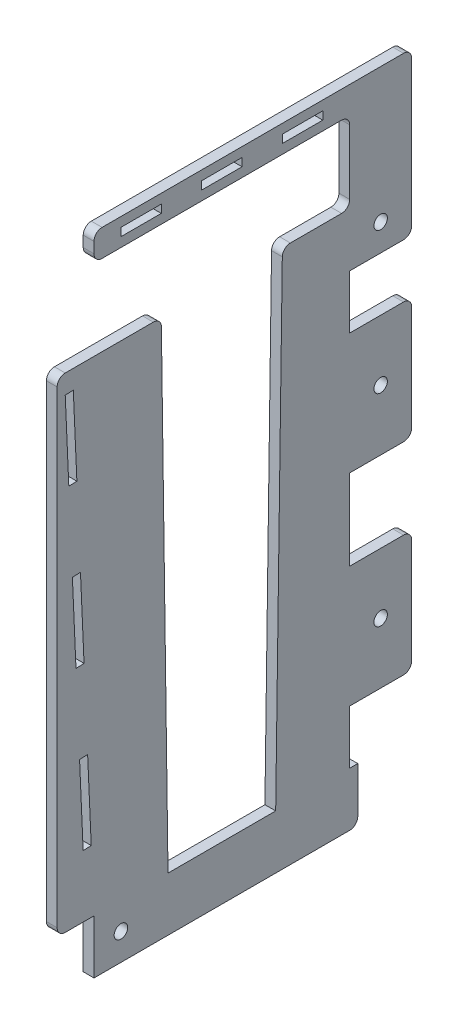
from build123d import *

# Parameters (mm, degrees)
SKETCH1_R           = 2.5
BOSS_EXTRUDE1_DEPTH = 4
SKETCH4_W           = 15
SKETCH4_H           = 3
BOSS_EXTRUDE2_DEPTH = 4
SKETCH5_W           = 13.685275767
SKETCH5_H           = 180
BOSS_EXTRUDE3_DEPTH = 4
CUT_EXTRUDE3_DEPTH  = 4
SKETCH11_W          = 3
SKETCH11_H          = 20
BOSS_EXTRUDE5_DEPTH = 4
FILLET1_R           = 3
SKETCH12_R          = 2.5
CUT_EXTRUDE7_DEPTH  = 4


with BuildPart() as part:
    # Sketch1 → Boss-Extrude1 (new body)
    with BuildSketch(Plane(origin=(0, 0, 0), x_dir=(0, 0, -1), z_dir=(1, 0, 0))):
        Polygon((0, 0), (-95, 0), (-95, 200), (23, 200), (23, 180), (0, 180), (0, 160), (23, 160), (23, 115), (0, 115), (0, 85), (23, 85), (23, 40), (0, 40), align=None)
        with Locations((11.5, 190)):
            Circle(SKETCH1_R, mode=Mode.SUBTRACT)
        with Locations((11.5, 137.5)):
            Circle(SKETCH1_R, mode=Mode.SUBTRACT)
        with Locations((11.5, 62.5)):
            Circle(SKETCH1_R, mode=Mode.SUBTRACT)
    extrude(amount=BOSS_EXTRUDE1_DEPTH)

    # Sketch4 → Boss-Extrude2 (add)
    with BuildSketch(Plane(origin=(4, 0, 0), x_dir=(0, 0, -1), z_dir=(1, 0, 0))):
        Polygon((-95, 230), (0, 230), (0, 200), (23, 200), (23, 240), (0, 240), (-95, 240), align=None)
        with Locations((-77.5, 235)):
            Rectangle(SKETCH4_W, SKETCH4_H, mode=Mode.SUBTRACT)
        with Locations((-47.5, 235)):
            Rectangle(SKETCH4_W, SKETCH4_H, mode=Mode.SUBTRACT)
        with Locations((-17.5, 235)):
            Rectangle(SKETCH4_W, SKETCH4_H, mode=Mode.SUBTRACT)
    extrude(amount=-BOSS_EXTRUDE2_DEPTH)

    # Sketch5 → Boss-Extrude3 (add)
    with BuildSketch(Plane(origin=(4, 0, 0), x_dir=(0, 0, -1), z_dir=(1, 0, 0))):
        with Locations((-101.842637884, 110)):
            Rectangle(SKETCH5_W, SKETCH5_H)
        Polygon((-97.360160713, 73.103616035), (-96.028142304, 43.133201841), (-99.025183723, 43), (-100.357202132, 72.970414194), align=None, mode=Mode.SUBTRACT)
        Polygon((-100.02419753, 133.044444423), (-98.692179121, 103.074030229), (-101.689220541, 102.940828388), (-103.021238949, 132.911242582), align=None, mode=Mode.SUBTRACT)
        Polygon((-102.688234347, 192.985272811), (-101.356215939, 163.014858617), (-104.353257358, 162.881656776), (-105.685275767, 192.85207097), align=None, mode=Mode.SUBTRACT)
    extrude(amount=-BOSS_EXTRUDE3_DEPTH)

    # Sketch6 → Cut-Extrude3 (cut)
    with BuildSketch(Plane(origin=(4, 0, 0), x_dir=(0, 0, -1), z_dir=(1, 0, 0))):
        Polygon((-25, 200), (-70, 200), (-67.5, 20), (-27.5, 20), align=None)
    extrude(amount=-CUT_EXTRUDE3_DEPTH, mode=Mode.SUBTRACT)

    # Sketch11 → Boss-Extrude5 (add)
    with BuildSketch(Plane.ZY):
        with Locations((-1.5, 10)):
            Rectangle(SKETCH11_W, SKETCH11_H)
    extrude(amount=-BOSS_EXTRUDE5_DEPTH)

    # Fillet1
    fillet1_edges = [part.edges().sort_by_distance(p)[0] for p in [
        (2, 200, 70),
        (2, 200, 25),
        (2, 20, 108.685275767),
        (2, 40, -23),
        (2, 85, -23),
        (2, 115, -23),
        (2, 160, -23),
        (2, 180, -23),
        (2, 240, -23),
        (2, 200, 0),
        (2, 230, 0),
        (2, 230, 95),
        (2, 240, 95),
        (2, 200, 108.685275767),
        (2, 0, -3),
    ]]
    fillet(fillet1_edges, radius=FILLET1_R)

    # Sketch12 → Cut-Extrude7 (cut)
    with BuildSketch(Plane(origin=(4, 0, 0), x_dir=(0, 0, -1), z_dir=(1, 0, 0))):
        with Locations((-85, 10)):
            Circle(SKETCH12_R)
    extrude(amount=-CUT_EXTRUDE7_DEPTH, mode=Mode.SUBTRACT)


solid = part.part
